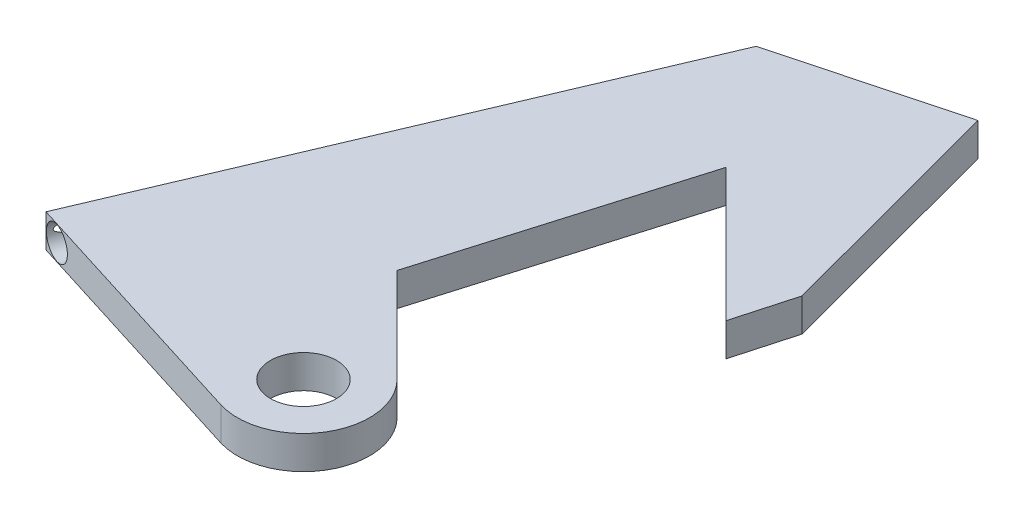
from build123d import *

# Parameters (mm, degrees)
SKETCH1_R                       = 4.7625
BOSS_EXTRUDE1_DEPTH             = 4.7625
F_14_0_182_DIAMETER_HOLE1_D     = 4.6228
F_14_0_182_DIAMETER_HOLE1_DEPTH = 2.54
F_14_0_182_DIAMETER_HOLE1_TIP   = 1.388829235


with BuildPart() as part:
    # Sketch1 → Boss-Extrude1 (new body)
    with BuildSketch(Plane(origin=(0, 0, 0), x_dir=(1, 0, 0), z_dir=(0, 1, 0))):
        with BuildLine():
            Line((6.680265303, 23.80457534), (-18.540909608, 17.0908469))
            Line((-18.540909608, 17.0908469), (-49.036599536, -54.676704123))
            Line((-49.036599536, -54.676704123), (-12.38156047, -66.157106701))
            ThreePointArc((-12.38156047, -66.157106701), (-1.47172138, -62.045085351), (-2.715472603, -50.452570894))
            Line((-2.715472603, -50.452570894), (-16.449210706, -36.716165316))
            Line((-16.449210706, -36.716165316), (-5.628226073, -0.185133418))
            Line((-5.628226073, -0.185133418), (13.49797674, -19.31133623))
            Line((13.49797674, -19.31133623), (15.879471691, -10.753687697))
            Line((15.879471691, -10.753687697), (6.680265303, 23.80457534))
        make_face()
        with Locations((-9.583361485, -57.052398719)):
            Circle(SKETCH1_R, mode=Mode.SUBTRACT)
    extrude(amount=BOSS_EXTRUDE1_DEPTH)

    # #14 (0.182) Diameter Hole1
    with Locations(Plane(origin=(-19.975553156, 0, 63.778659005), x_dir=(0.9542892760421929, 0, 0.29888455569143635), z_dir=(-0.29888455569143635, 0, 0.9542892760421929))):
        with Locations((-28.063756274, 2.38125)):
            Hole(F_14_0_182_DIAMETER_HOLE1_D / 2, depth=F_14_0_182_DIAMETER_HOLE1_DEPTH)
            with Locations((0, 0, -(F_14_0_182_DIAMETER_HOLE1_DEPTH + F_14_0_182_DIAMETER_HOLE1_TIP / 2))):  # 118° drill point
                Cone(0, F_14_0_182_DIAMETER_HOLE1_D / 2, F_14_0_182_DIAMETER_HOLE1_TIP, mode=Mode.SUBTRACT)


solid = part.part
